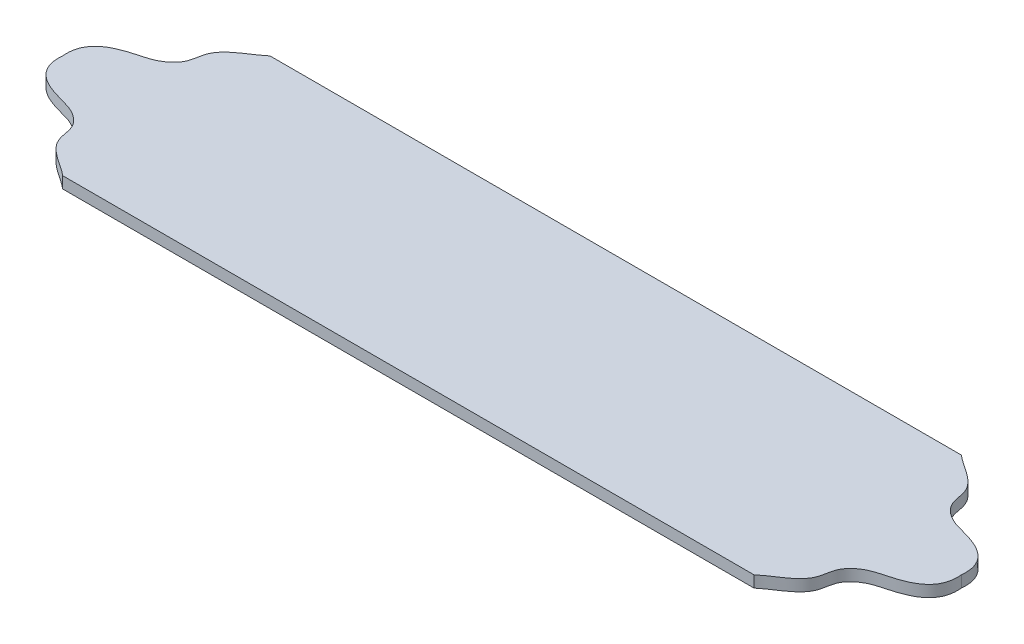
from build123d import *

# Parameters (mm, degrees)
BOSS_EXTRUDE1_DEPTH = 12.7


with BuildPart() as part:
    # Sketch1 → Boss-Extrude1 (new body)
    with BuildSketch(Plane(origin=(0, 0, 0), x_dir=(1, 0, 0), z_dir=(0, 1, 0))):
        with BuildLine():
            Line((-381, -114.3), (381, -114.3))
            add(Edge.make_bspline(
                [(495.3, 0), (497.979210737, -25.818625539), (471.419723645, -38.982231972), (438.381689478, -45.824112284), (419.955895798, -60.517454255), (419.426708334, -93.428336374), (392.296915343, -104.3239486), (381, -114.3)],
                knots=[0, 0, 0, 0, 0.342208171, 0.464464627, 0.602139561, 0.710952034, 1, 1, 1, 1], degree=3))
            add(Edge.make_bspline(
                [(495.3, 0), (497.979210737, 25.818625539), (471.419723645, 38.982231972), (438.381689478, 45.824112284), (419.955895798, 60.517454255), (419.426708334, 93.428336374), (392.296915343, 104.3239486), (381, 114.3)],
                knots=[0, 0, 0, 0, 0.342208171, 0.464464627, 0.602139561, 0.710952034, 1, 1, 1, 1], degree=3))
            Line((381, 114.3), (-381, 114.3))
            add(Edge.make_bspline(
                [(-495.3, 0), (-497.979210737, 25.818625539), (-471.419723645, 38.982231972), (-438.381689478, 45.824112284), (-419.955895798, 60.517454255), (-419.426708334, 93.428336374), (-392.296915343, 104.3239486), (-381, 114.3)],
                knots=[0, 0, 0, 0, 0.342208171, 0.464464627, 0.602139561, 0.710952034, 1, 1, 1, 1], degree=3))
            add(Edge.make_bspline(
                [(-495.3, 0), (-497.979210737, -25.818625539), (-471.419723645, -38.982231972), (-438.381689478, -45.824112284), (-419.955895798, -60.517454255), (-419.426708334, -93.428336374), (-392.296915343, -104.3239486), (-381, -114.3)],
                knots=[0, 0, 0, 0, 0.342208171, 0.464464627, 0.602139561, 0.710952034, 1, 1, 1, 1], degree=3))
        make_face()
    extrude(amount=BOSS_EXTRUDE1_DEPTH)


solid = part.part
